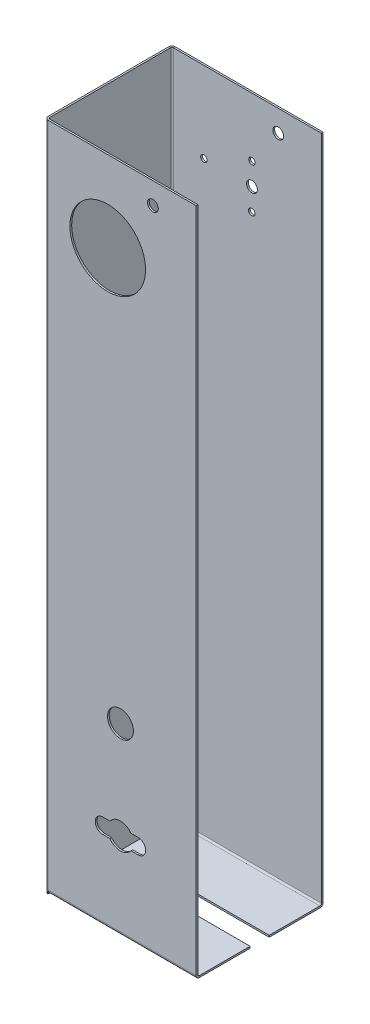
from build123d import *

# Parameters (mm, degrees)
SKETCH1_W                      = 70
SKETCH1_H                      = 310
BASE_FLANGE1_DEPTH             = 0.81
EDGE_FLANGE1_STRIP_W           = 4.7132
EDGE_FLANGE1_STRIP_H           = 0.81
EDGE_FLANGE1_STRIP_CUT_DEPTH   = 310
EDGE_FLANGE1_DEPTH             = 310
EDGE_FLANGE2_STRIP_W           = 4.7132
EDGE_FLANGE2_STRIP_H           = 0.81
EDGE_FLANGE2_STRIP_CUT_DEPTH   = 310
EDGE_FLANGE2_DEPTH             = 310
EDGE_FLANGE3_STRIP_W           = 4.7132
EDGE_FLANGE3_STRIP_H           = 0.81
EDGE_FLANGE3_STRIP_CUT_DEPTH   = 68.4534
EDGE_FLANGE3_STRIP_2_W         = 4.7132
EDGE_FLANGE3_STRIP_2_H         = 0.81
EDGE_FLANGE3_STRIP_CUT_2_DEPTH = 68.4534
EDGE_FLANGE3_DEPTH             = 68.4534
EDGE_FLANGE3_BEND_DEPTH        = 68.4534
CUT_EXTRUDE2_REACH             = 325.201
SKETCH18_R                     = 2.5
SKETCH18_R_2                   = 1.5
CUT_EXTRUDE1_REACH             = 325.201
SKETCH17_R                     = 17.5
SKETCH17_R_2                   = 2.5
SKETCH17_R_3                   = 6


# Sheet-metal steps are written as plain solids
with BuildPart() as part:
    # Sketch1 → Base-Flange1 (new body)
    with BuildSketch(Plane.XY):
        with Locations((35, 155)):
            Rectangle(SKETCH1_W, SKETCH1_H)
    extrude(amount=-BASE_FLANGE1_DEPTH)

    # Edge-Flange1 strip (across the edge) → Edge-Flange1 strip cut (cut)
    with BuildSketch(Plane(origin=(0, 0, -0.81), x_dir=(1, 0, 0), z_dir=(0, 1, 0))):
        with Locations((-0.81, -0.405)):
            Rectangle(EDGE_FLANGE1_STRIP_W, EDGE_FLANGE1_STRIP_H)
    extrude(amount=EDGE_FLANGE1_STRIP_CUT_DEPTH, mode=Mode.SUBTRACT)

    # Edge-Flange1 section (across the edge) → Edge-Flange1 (add)
    with BuildSketch(Plane(origin=(0, 0, -0.81), x_dir=(1, 0, 0), z_dir=(0, 1, 0))):
        with BuildLine():
            Line((0, 0.7366), (0, 58))
            Line((0, 58), (0.81, 58))
            Line((0.81, 58), (0.81, 0.7366))
            ThreePointArc((0.81, 0.7366), (1.025745145, 0.215745145), (1.5466, 0))
            Line((1.5466, 0), (1.5466, -0.81))
            ThreePointArc((1.5466, -0.81), (0.452988652, -0.357011348), (0, 0.7366))
        make_face()
    extrude(amount=EDGE_FLANGE1_DEPTH)

    # Edge-Flange2 strip (across the edge) → Edge-Flange2 strip cut (cut)
    with BuildSketch(Plane(origin=(0.81, 0, -58.81), x_dir=(0, 0, 1), z_dir=(0, 1, 0))):
        with Locations((-0.81, -0.405)):
            Rectangle(EDGE_FLANGE2_STRIP_W, EDGE_FLANGE2_STRIP_H)
    extrude(amount=EDGE_FLANGE2_STRIP_CUT_DEPTH, mode=Mode.SUBTRACT)

    # Edge-Flange2 section (across the edge) → Edge-Flange2 (add)
    with BuildSketch(Plane(origin=(0.81, 0, -58.81), x_dir=(0, 0, 1), z_dir=(0, 1, 0))):
        with BuildLine():
            Line((0, 0.7366), (0, 69.19))
            Line((0, 69.19), (0.81, 69.19))
            Line((0.81, 69.19), (0.81, 0.7366))
            ThreePointArc((0.81, 0.7366), (1.025745145, 0.215745145), (1.5466, 0))
            Line((1.5466, 0), (1.5466, -0.81))
            ThreePointArc((1.5466, -0.81), (0.452988652, -0.357011348), (0, 0.7366))
        make_face()
    extrude(amount=EDGE_FLANGE2_DEPTH)

    # Edge-Flange3 strip (across the edge) → Edge-Flange3 strip cut (cut)
    with BuildSketch(Plane(origin=(70, 0, -0.81), x_dir=(0, 1, 0), z_dir=(-1, 0, 0))):
        with Locations((-0.81, -0.405)):
            Rectangle(EDGE_FLANGE3_STRIP_W, EDGE_FLANGE3_STRIP_H)
    extrude(amount=EDGE_FLANGE3_STRIP_CUT_DEPTH, mode=Mode.SUBTRACT)

    # Edge-Flange3 strip 2 (across the edge) → Edge-Flange3 strip cut 2 (cut)
    with BuildSketch(Plane(origin=(1.5466, 0, -58), x_dir=(0, 1, 0), z_dir=(1, 0, 0))):
        with Locations((-0.81, -0.405)):
            Rectangle(EDGE_FLANGE3_STRIP_2_W, EDGE_FLANGE3_STRIP_2_H)
    extrude(amount=EDGE_FLANGE3_STRIP_CUT_2_DEPTH, mode=Mode.SUBTRACT)

    # Edge-Flange3 section (across the edge) → Edge-Flange3 (add)
    with BuildSketch(Plane(origin=(70, 0, -0.81), x_dir=(0, 1, 0), z_dir=(-1, 0, 0))):
        with BuildLine():
            Line((0, 0.7366), (0, 24.19))
            Line((0, 24.19), (0.81, 24.19))
            Line((0.81, 24.19), (0.81, 0.7366))
            ThreePointArc((0.81, 0.7366), (1.025745145, 0.215745145), (1.5466, 0))
            Line((1.5466, 0), (1.5466, -0.81))
            ThreePointArc((1.5466, -0.81), (0.452988652, -0.357011348), (0, 0.7366))
        make_face()
    extrude(amount=EDGE_FLANGE3_DEPTH)

    # Edge-Flange3 section 2 (across the edge) → Edge-Flange3 bend (add)
    with BuildSketch(Plane(origin=(1.5466, 0, -58), x_dir=(0, 1, 0), z_dir=(1, 0, 0))):
        with BuildLine():
            Line((0, 0.7366), (0, 24.19))
            Line((0, 24.19), (0.81, 24.19))
            Line((0.81, 24.19), (0.81, 0.7366))
            ThreePointArc((0.81, 0.7366), (1.025745145, 0.215745145), (1.5466, 0))
            Line((1.5466, 0), (1.5466, -0.81))
            ThreePointArc((1.5466, -0.81), (0.452988652, -0.357011348), (0, 0.7366))
        make_face()
    extrude(amount=EDGE_FLANGE3_BEND_DEPTH)

    # Sketch18 → Cut-Extrude2 (cut, up to next)
    with BuildSketch(Plane.XY.offset(-58.81), mode=Mode.PRIVATE) as cut_extrude2_sk1:
        with Locations(Location((37.83811715, 272.529876457, 0), (0, 0, 180))):
            Circle(SKETCH18_R)
    cut_extrude2_tool1 = extrude(cut_extrude2_sk1.sketch, amount=CUT_EXTRUDE2_REACH, mode=Mode.PRIVATE) & part.part
    # Sketch18 → Cut-Extrude2 (cut, up to next)
    with BuildSketch(Plane.XY.offset(-58.81), mode=Mode.PRIVATE) as cut_extrude2_sk2:
        with Locations(Location((50, 300, 0), (0, 0, 180))):
            Circle(SKETCH18_R)
    cut_extrude2_tool2 = extrude(cut_extrude2_sk2.sketch, amount=CUT_EXTRUDE2_REACH, mode=Mode.PRIVATE) & part.part
    # Sketch18 → Cut-Extrude2 (cut, up to next)
    with BuildSketch(Plane.XY.offset(-58.81), mode=Mode.PRIVATE) as cut_extrude2_sk3:
        with Locations(Location((37.721227194, 262.319243723, 0), (0, 0, 180))):
            Circle(SKETCH18_R_2)
    cut_extrude2_tool3 = extrude(cut_extrude2_sk3.sketch, amount=CUT_EXTRUDE2_REACH, mode=Mode.PRIVATE) & part.part
    # Sketch18 → Cut-Extrude2 (cut, up to next)
    with BuildSketch(Plane.XY.offset(-58.81), mode=Mode.PRIVATE) as cut_extrude2_sk4:
        with Locations(Location((37.83811715, 282.740509191, 0), (0, 0, 180))):
            Circle(SKETCH18_R_2)
    cut_extrude2_tool4 = extrude(cut_extrude2_sk4.sketch, amount=CUT_EXTRUDE2_REACH, mode=Mode.PRIVATE) & part.part
    # Sketch18 → Cut-Extrude2 (cut, up to next)
    with BuildSketch(Plane.XY.offset(-58.81), mode=Mode.PRIVATE) as cut_extrude2_sk5:
        with Locations(Location((15.605835414, 272.656798014, 0), (0, 0, 180))):
            Circle(SKETCH18_R_2)
    cut_extrude2_tool5 = extrude(cut_extrude2_sk5.sketch, amount=CUT_EXTRUDE2_REACH, mode=Mode.PRIVATE) & part.part
    add(cut_extrude2_tool1.solids().sort_by_distance((37.838117, 272.529876, -58.81))[0], mode=Mode.SUBTRACT)
    add(cut_extrude2_tool2.solids().sort_by_distance((50, 300, -58.81))[0], mode=Mode.SUBTRACT)
    add(cut_extrude2_tool3.solids().sort_by_distance((37.721227, 262.319244, -58.81))[0], mode=Mode.SUBTRACT)
    add(cut_extrude2_tool4.solids().sort_by_distance((37.838117, 282.740509, -58.81))[0], mode=Mode.SUBTRACT)
    add(cut_extrude2_tool5.solids().sort_by_distance((15.605835, 272.656798, -58.81))[0], mode=Mode.SUBTRACT)

    # Sketch17 → Cut-Extrude1 (cut, up to next)
    with BuildSketch(Plane(origin=(0, 0, 0), x_dir=(-1, 0, 0), z_dir=(0, 0, -1)), mode=Mode.PRIVATE) as cut_extrude1_sk1:
        with Locations((-29.120132649, 272.629176961)):
            Circle(SKETCH17_R)
    cut_extrude1_tool1 = extrude(cut_extrude1_sk1.sketch, amount=CUT_EXTRUDE1_REACH, mode=Mode.PRIVATE) & part.part
    # Sketch17 → Cut-Extrude1 (cut, up to next)
    with BuildSketch(Plane(origin=(0, 0, 0), x_dir=(-1, 0, 0), z_dir=(0, 0, -1)), mode=Mode.PRIVATE) as cut_extrude1_sk2:
        with Locations((-50, 300)):
            Circle(SKETCH17_R_2)
    cut_extrude1_tool2 = extrude(cut_extrude1_sk2.sketch, amount=CUT_EXTRUDE1_REACH, mode=Mode.PRIVATE) & part.part
    # Sketch17 → Cut-Extrude1 (cut, up to next)
    with BuildSketch(Plane(origin=(0, 0, 0), x_dir=(-1, 0, 0), z_dir=(0, 0, -1)), mode=Mode.PRIVATE) as cut_extrude1_sk3:
        with Locations((-35, 85)):
            Circle(SKETCH17_R_3)
    cut_extrude1_tool3 = extrude(cut_extrude1_sk3.sketch, amount=CUT_EXTRUDE1_REACH, mode=Mode.PRIVATE) & part.part
    # Sketch17 → Cut-Extrude1 (cut, up to next)
    with BuildSketch(Plane(origin=(0, 0, 0), x_dir=(-1, 0, 0), z_dir=(0, 0, -1)), mode=Mode.PRIVATE) as cut_extrude1_sk4:
        with BuildLine():
            Line((-43.15, 43.5), (-39.873397172, 43.5))
            ThreePointArc((-39.873397172, 43.5), (-35, 46), (-30.126602828, 43.5))
            Line((-30.126602828, 43.5), (-26.85, 43.5))
            ThreePointArc((-26.85, 43.5), (-23.35, 40), (-26.85, 36.5))
            Line((-26.85, 36.5), (-30.126602828, 36.5))
            ThreePointArc((-30.126602828, 36.5), (-35, 34), (-39.873397172, 36.5))
            Line((-39.873397172, 36.5), (-43.15, 36.5))
            ThreePointArc((-43.15, 36.5), (-46.65, 40), (-43.15, 43.5))
        make_face()
    cut_extrude1_tool4 = extrude(cut_extrude1_sk4.sketch, amount=CUT_EXTRUDE1_REACH, mode=Mode.PRIVATE) & part.part
    add(cut_extrude1_tool1.solids().sort_by_distance((29.120133, 272.629177, 0))[0], mode=Mode.SUBTRACT)
    add(cut_extrude1_tool2.solids().sort_by_distance((50, 300, 0))[0], mode=Mode.SUBTRACT)
    add(cut_extrude1_tool3.solids().sort_by_distance((35, 85, 0))[0], mode=Mode.SUBTRACT)
    add(cut_extrude1_tool4.solids().sort_by_distance((35, 40, 0))[0], mode=Mode.SUBTRACT)


solid = part.part
